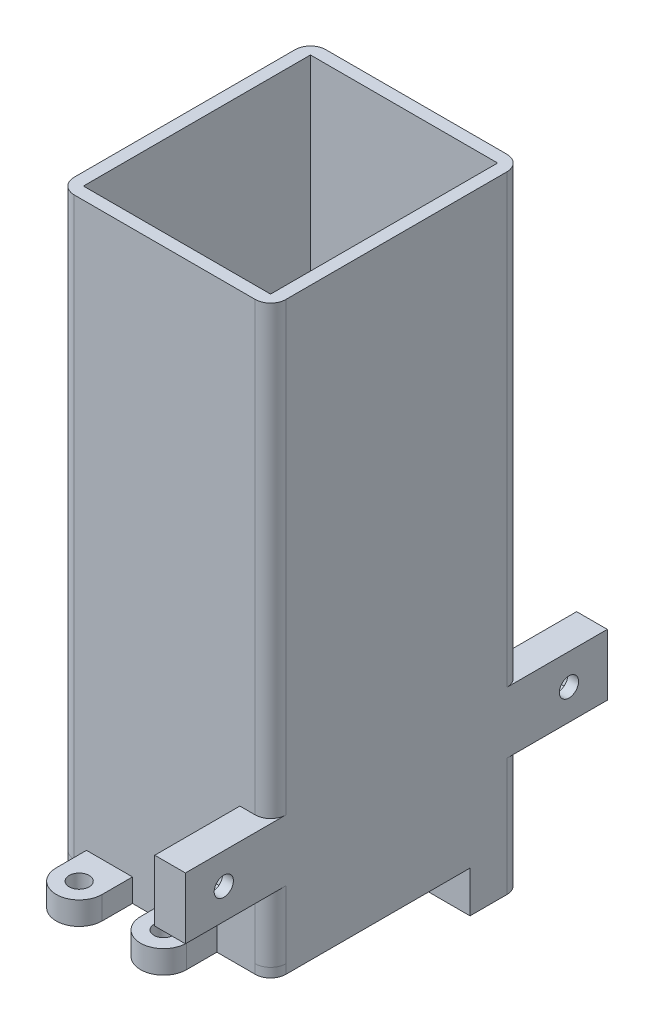
from build123d import *

# Parameters (mm, degrees)
SKETCH2_W               = 35.052
SKETCH2_H               = 41.656
SKETCH2_W_2             = 30.988
SKETCH2_H_2             = 37.592
BOSS_EXTRUDE2_DEPTH     = 101.6
SKETCH3_W               = 35.052
SKETCH3_H               = 41.656
BOSS_EXTRUDE3_DEPTH     = 2.032
CUT_EXTRUDE1_DEPTH      = 29.21
CUT_EXTRUDE1_DEPTH_BACK = 114.942712694
SKETCH4_R               = 12.7
BOSS_EXTRUDE4_DEPTH     = 31.75
FILLET1_R               = 0.254
FILLET2_R               = 2.54
FILLET3_R               = 0.508
SKETCH7_W               = 29.21
SKETCH7_H               = 8.382
CUT_EXTRUDE2_DEPTH      = 115.548086322
SKETCH8_W               = 29.21
SKETCH8_H               = 1.524
BOSS_EXTRUDE5_DEPTH     = 35.052
FILLET6_R               = 2.54
SKETCH9_R               = 12.7
CUT_EXTRUDE3_DEPTH      = 109.318716216
FILLET7_R               = 0.508
BOSS_EXTRUDE6_DEPTH     = 4.064
SKETCH12_W              = 3.81
SKETCH12_H              = 4.318
CUT_EXTRUDE4_DEPTH      = 115.548086352
SKETCH14_W              = 69.85
SKETCH14_H              = 10.16
BOSS_EXTRUDE7_DEPTH     = 5.08
SKETCH16_W              = 30.988
SKETCH16_H              = 37.592
CUT_EXTRUDE5_DEPTH      = 93.98
SKETCH17_R              = 1.5875
CUT_EXTRUDE6_DEPTH      = 121.154685934
CUT_EXTRUDE7_DEPTH      = 3.302
SKETCH19_R              = 1.5875
BOSS_EXTRUDE10_DEPTH    = 3.81
SKETCH19_R_2            = 1.651
BOSS_EXTRUDE10_2_DEPTH  = 3.81
SKETCH20_R              = 1.651
SKETCH20_R_2            = 1.5875
BOSS_EXTRUDE11_DEPTH    = 2.54
SKETCH21_W              = 3.81
SKETCH21_H              = 2.54
CUT_EXTRUDE8_DEPTH      = 121.154685934


with BuildPart() as part:
    # Sketch2 → Boss-Extrude2 (new body)
    with BuildSketch(Plane(origin=(0, 0, 0), x_dir=(1, 0, 0), z_dir=(0, 1, 0))):
        with Locations((15.494, 18.796)):
            Rectangle(SKETCH2_W, SKETCH2_H)
        with Locations((15.494, 18.796)):
            Rectangle(SKETCH2_W_2, SKETCH2_H_2, mode=Mode.SUBTRACT)
    extrude(amount=BOSS_EXTRUDE2_DEPTH)

    # Sketch3 → Boss-Extrude3 (add)
    with BuildSketch(Plane.XZ):
        with Locations((15.494, -18.796)):
            Rectangle(SKETCH3_W, SKETCH3_H)
    extrude(amount=BOSS_EXTRUDE3_DEPTH)

    # Sketch4 → Cut-Extrude1 (cut, two sides: drawn at the far end of the back side and taken through both)
    with BuildSketch(Plane(origin=(0, 0, 0), x_dir=(1, 0, 0), z_dir=(0, 1, 0)).offset(-CUT_EXTRUDE1_DEPTH_BACK)):
        with Locations(Location((16.51, 14.224, 0), (0, 0, 90))):
            Circle(SKETCH4_R)
    extrude(amount=CUT_EXTRUDE1_DEPTH + CUT_EXTRUDE1_DEPTH_BACK, mode=Mode.SUBTRACT)

    # Sketch6 → Boss-Extrude4 (add)
    with BuildSketch(Plane(origin=(0, 0, 0), x_dir=(0, 0, -1), z_dir=(1, 0, 0))):
        Polygon((37.592, 0), (31.242, 0), (31.242, 7.112), align=None)
    extrude(amount=BOSS_EXTRUDE4_DEPTH)

    # Fillet1
    fillet1_edges = [part.edges().sort_by_distance(p)[0] for p in [
        (15.494, 7.112, -31.242),
    ]]
    fillet(fillet1_edges, radius=FILLET1_R)

    # Fillet2
    fillet2_edges = [part.edges().sort_by_distance(p)[0] for p in [
        (-2.032, 49.784, -39.624),
        (33.02, 49.784, -39.624),
        (33.02, 49.784, 2.032),
        (-2.032, 49.784, 2.032),
    ]]
    fillet(fillet2_edges, radius=FILLET2_R)

    # Fillet3
    fillet3_edges = [part.edges().sort_by_distance(p)[0] for p in [
        (16.51, 0, -1.524),
        (16.51, -2.032, -1.524),
    ]]
    fillet(fillet3_edges, radius=FILLET3_R)

    # Sketch7 → Cut-Extrude2 (cut, through all)
    with BuildSketch(Plane(origin=(33.02, 0, 0), x_dir=(0, 0, -1), z_dir=(1, 0, 0))):
        with Locations((12.573, 2.159)):
            Rectangle(SKETCH7_W, SKETCH7_H)
    extrude(amount=-CUT_EXTRUDE2_DEPTH, mode=Mode.SUBTRACT)

    # Sketch8 → Boss-Extrude5 (add, through all)
    with BuildSketch(Plane(origin=(33.02, 0, 0), x_dir=(0, 0, -1), z_dir=(1, 0, 0))):
        with Locations((12.573, 5.588)):
            Rectangle(SKETCH8_W, SKETCH8_H)
    extrude(amount=-BOSS_EXTRUDE5_DEPTH)

    # Fillet6
    fillet6_edges = [part.edges().sort_by_distance(p)[0] for p in [
        (-2.032, 5.588, 2.032),
        (33.02, 5.588, 2.032),
    ]]
    fillet(fillet6_edges, radius=FILLET6_R)

    # Sketch9 → Cut-Extrude3 (cut, through all)
    with BuildSketch(Plane(origin=(0, 6.35, 0), x_dir=(1, 0, 0), z_dir=(0, 1, 0))):
        with Locations(Location((16.51, 14.224, 0), (0, 0, 270))):
            Circle(SKETCH9_R)
    extrude(amount=-CUT_EXTRUDE3_DEPTH, mode=Mode.SUBTRACT)

    # Fillet7
    # the kernel refuses this fillet: 0.508 mm, written as the material it takes off along each edge
    with BuildSketch(Plane(origin=(16.51, 4.826, -14.224), x_dir=(0, 0, 1), z_dir=(-1, 0, 0))) as fillet7_piece_1:
        with BuildLine():
            CenterArc((12.7 + FILLET7_R, FILLET7_R), FILLET7_R, 180, 90)
            Line((12.7, FILLET7_R), (12.7, 0))
            Line((12.7, 0), (12.7 + FILLET7_R, 0))
        make_face()
    revolve(axis=Axis((16.51, 4.826, -14.224), (0, 1, 0)), mode=Mode.SUBTRACT)
    with BuildSketch(Plane(origin=(16.51, 6.35, -14.224), x_dir=(0, 0, 1), z_dir=(-1, 0, 0))) as fillet7_piece_2:
        with BuildLine():
            CenterArc((12.7 + FILLET7_R, -FILLET7_R), FILLET7_R, 90, 90)
            Line((12.7 + FILLET7_R, 0), (12.7, 0))
            Line((12.7, 0), (12.7, -FILLET7_R))
        make_face()
    revolve(axis=Axis((16.51, 6.35, -14.224), (0, 1, 0)), mode=Mode.SUBTRACT)

    # Sketch11 → Boss-Extrude6 (add)
    with BuildSketch(Plane.XY.offset(-31.242)):
        Polygon((-2.032, -2.032), (30.226, -2.032), (33.02, -2.032), (33.02, 6.35), (-2.032, 6.35), align=None)
    extrude(amount=BOSS_EXTRUDE6_DEPTH)

    # Sketch12 → Cut-Extrude4 (cut, through all)
    with BuildSketch(Plane.ZY.offset(2.032)):
        with Locations((-29.083, 0.127)):
            Rectangle(SKETCH12_W, SKETCH12_H)
    extrude(amount=-CUT_EXTRUDE4_DEPTH, mode=Mode.SUBTRACT)

    # Sketch14 → Boss-Extrude7 (add)
    with BuildSketch(Plane(origin=(33.02, 0, 0), x_dir=(0, 0, -1), z_dir=(1, 0, 0))):
        with Locations((18.796, 22.606)):
            Rectangle(SKETCH14_W, SKETCH14_H)
    extrude(amount=-BOSS_EXTRUDE7_DEPTH)

    # Sketch16 → Cut-Extrude5 (cut)
    with BuildSketch(Plane(origin=(0, 101.6, 0), x_dir=(1, 0, 0), z_dir=(0, 1, 0))):
        with Locations((15.494, 18.796)):
            Rectangle(SKETCH16_W, SKETCH16_H)
    extrude(amount=-CUT_EXTRUDE5_DEPTH, mode=Mode.SUBTRACT)

    # Sketch17 → Cut-Extrude6 (cut, through all)
    with BuildSketch(Plane(origin=(33.02, 0, 0), x_dir=(0, 0, -1), z_dir=(1, 0, 0))):
        with Locations((-9.779, 22.606)):
            Circle(SKETCH17_R)
        with Locations((47.371, 22.606)):
            Circle(SKETCH17_R)
    extrude(amount=-CUT_EXTRUDE6_DEPTH, mode=Mode.SUBTRACT)

    # Sketch18 → Cut-Extrude7 (cut)
    with BuildSketch(Plane.ZY.offset(-27.94)):
        Polygon((-46.393453096, 19.719010902), (-44.382020649, 22.009085903), (-45.359567553, 24.896075001), (-48.348546904, 25.492989098), (-50.359979351, 23.202914097), (-49.382432447, 20.315924999), align=None)
        Polygon((10.756546904, 19.719010902), (12.767979351, 22.009085903), (11.790432447, 24.896075001), (8.801453096, 25.492989098), (6.790020649, 23.202914097), (7.767567553, 20.315924999), align=None)
    extrude(amount=-CUT_EXTRUDE7_DEPTH, mode=Mode.SUBTRACT)

    # Sketch20 → Boss-Extrude11 (add)
    # profile 1 of 2: a face of its own
    with BuildSketch(Plane.XZ.offset(2.032)):
        with BuildLine():
            Line((1.778, -39.624), (9.398, -39.624))
            Line((9.398, -39.624), (9.398, -44.64337725))
            ThreePointArc((9.398, -44.64337725), (5.588, -48.45337725), (1.778, -44.64337725))
            Line((1.778, -44.64337725), (1.778, -39.624))
        make_face()
        with Locations(Location((5.588, -44.64337725, 0), (0, 0, 90))):
            Circle(SKETCH20_R, mode=Mode.SUBTRACT)
    # profile 2 of 2: a face of its own
    with BuildSketch(Plane.XZ.offset(2.032)):
        with BuildLine():
            Line((15.748, -39.624), (23.368, -39.624))
            Line((23.368, -39.624), (23.368, -44.64337725))
            ThreePointArc((23.368, -44.64337725), (19.558, -48.45337725), (15.748, -44.64337725))
            Line((15.748, -44.64337725), (15.748, -39.624))
        make_face()
        with Locations(Location((19.558, -44.64337725, 0), (0, 0, 90))):
            Circle(SKETCH20_R_2, mode=Mode.SUBTRACT)
    extrude(amount=-BOSS_EXTRUDE11_DEPTH)

    # Sketch21 → Cut-Extrude8 (cut, through all)
    with BuildSketch(Plane(origin=(33.02, 0, 0), x_dir=(0, 0, -1), z_dir=(1, 0, 0))):
        with Locations((29.083, 3.556)):
            Rectangle(SKETCH21_W, SKETCH21_H)
    extrude(amount=-CUT_EXTRUDE8_DEPTH, mode=Mode.SUBTRACT)


with BuildPart() as body_2:
    # Sketch19 → Boss-Extrude10 (new body)
    with BuildSketch(Plane.XZ.offset(-4.826)):
        with BuildLine():
            Line((24.13, 2.032), (24.13, 7.05137725))
            ThreePointArc((24.13, 7.05137725), (20.32, 10.86137725), (16.51, 7.05137725))
            Line((16.51, 7.05137725), (16.51, 2.032))
            Line((16.51, 2.032), (24.13, 2.032))
        make_face()
        with Locations(Location((20.32, 7.05137725, 0), (0, 0, 270))):
            Circle(SKETCH19_R, mode=Mode.SUBTRACT)
    extrude(amount=-BOSS_EXTRUDE10_DEPTH)


with BuildPart() as body_3:
    # Sketch19 → Boss-Extrude10 2 (new body)
    with BuildSketch(Plane.XZ.offset(-4.826)):
        with BuildLine():
            Line((10.16, 2.032), (10.16, 7.05137725))
            ThreePointArc((10.16, 7.05137725), (6.35, 10.86137725), (2.54, 7.05137725))
            Line((2.54, 7.05137725), (2.54, 2.032))
            Line((2.54, 2.032), (10.16, 2.032))
        make_face()
        with Locations(Location((6.35, 7.05137725, 0), (0, 0, 270))):
            Circle(SKETCH19_R_2, mode=Mode.SUBTRACT)
    extrude(amount=-BOSS_EXTRUDE10_2_DEPTH)


solid = Compound([part.part, body_2.part, body_3.part])
